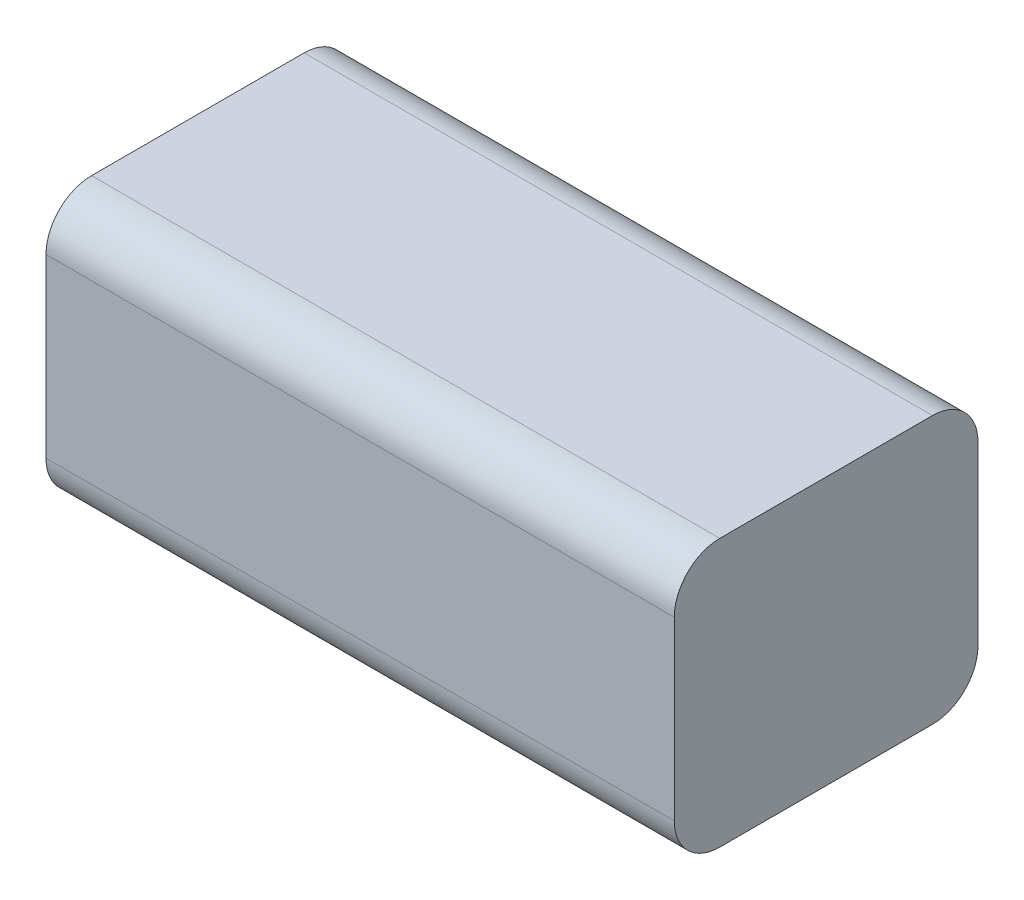
from build123d import *

# Parameters (mm, degrees)
SKETCH1_W           = 33.36
SKETCH1_H           = 29.37
BOSS_EXTRUDE1_DEPTH = 69
FILLET1_R           = 5
SCALE1_SCALE        = 0.7


with BuildPart() as part:
    # Sketch1 → Boss-Extrude1 (new body)
    with BuildSketch(Plane(origin=(0, 0, 0), x_dir=(0, 0, -1), z_dir=(1, 0, 0))):
        Rectangle(SKETCH1_W, SKETCH1_H)
    extrude(amount=BOSS_EXTRUDE1_DEPTH)

    # Fillet1
    fillet1_edges = [part.edges().sort_by_distance(p)[0] for p in [
        (34.5, -14.685, 16.68),
        (34.5, -14.685, -16.68),
        (34.5, 14.685, 16.68),
        (34.5, 14.685, -16.68),
    ]]
    fillet(fillet1_edges, radius=FILLET1_R)


with BuildPart() as part_1:
    # Scale1: scaled about (34.5, 0, 0)
    add(part.part.scale(SCALE1_SCALE).moved(Location((10.35, 0, 0))))


solid = part_1.part
